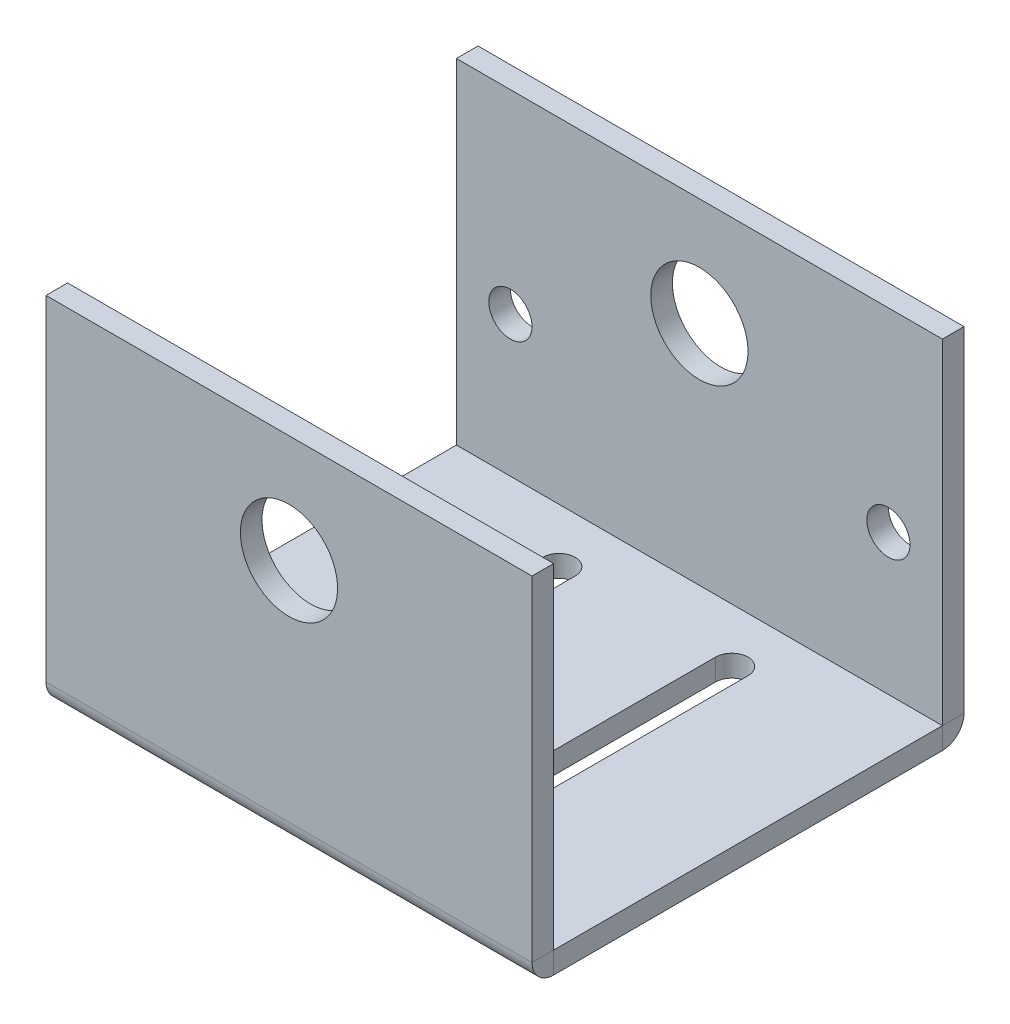
from build123d import *

# Parameters (mm, degrees)
SZKIC1_W                       = 45
SZKIC1_H                       = 40
ODGI_CIE_BAZOWE1_DEPTH         = 2
ODGI_CIE_START                 = -22.5
ODGI_CIE_KRAW_DZI1_DEPTH       = 45
ODGI_CIE_KRAW_DZI1_2_OUTLINE_W = 31
ODGI_CIE_KRAW_DZI1_2_OUTLINE_H = 2
ODGI_CIE_KRAW_DZI1_2_DEPTH     = 45
WYTNIJ_WYCI_GNI_CIE1_REACH     = 45.212
SZKIC13_R                      = 4.5
WYTNIJ_WYCI_GNI_CIE2_DEPTH     = 56.38275905
WYTNIJ_WYCI_GNI_CIE3_REACH     = 57.383
SZKIC14_R                      = 2


# Read off the part's stored shape, not the designer's step: Odgięcie krawędzi1
# Sheet-metal steps are written as plain solids
with BuildPart() as part:
    # Szkic1 → Odgięcie bazowe1 (new body)
    with BuildSketch(Plane(origin=(0, 0, 0), x_dir=(1, 0, 0), z_dir=(0, 1, 0))):
        Rectangle(SZKIC1_W, SZKIC1_H)
    extrude(amount=-ODGI_CIE_BAZOWE1_DEPTH)

    # Odgięcie krawędzi1 outline → Odgięcie krawędzi1 (cut)
    with BuildSketch(Plane.YZ.offset(ODGI_CIE_START)):
        with BuildLine():
            ThreePointArc((0, -20), (-1.414213562, -19.414213562), (-2, -18))
            Line((-2, -18), (-2, -20))
            Line((-2, -20), (0, -20))
        make_face()
        with BuildLine():
            Line((-2, 20), (-2, 18))
            ThreePointArc((-2, 18), (-1.414213562, 19.414213562), (0, 20))
            Line((0, 20), (-2, 20))
        make_face()
    extrude(amount=ODGI_CIE_KRAW_DZI1_DEPTH, mode=Mode.SUBTRACT)

    # Odgi_cie kraw_dzi1 2 outline → Odgi_cie kraw_dzi1 2 (add)
    with BuildSketch(Plane.YZ.offset(ODGI_CIE_START)):
        with Locations((15.5, -19)):
            Rectangle(ODGI_CIE_KRAW_DZI1_2_OUTLINE_W, ODGI_CIE_KRAW_DZI1_2_OUTLINE_H)
        with Locations((15.5, 19)):
            Rectangle(ODGI_CIE_KRAW_DZI1_2_OUTLINE_W, ODGI_CIE_KRAW_DZI1_2_OUTLINE_H)
    extrude(amount=ODGI_CIE_KRAW_DZI1_2_DEPTH)

    # Szkic12 → Wytnij-wyciągnięcie1 (cut, up to next)
    with BuildSketch(Plane(origin=(0, 0, 0), x_dir=(1, 0, 0), z_dir=(0, 1, 0)), mode=Mode.PRIVATE) as wytnij_wyci_gni_cie1_sk1:
        with BuildLine():
            Line((-9.5, -13), (-9.5, 13))
            ThreePointArc((-9.5, 13), (-8, 14.5), (-6.5, 13))
            Line((-6.5, 13), (-6.5, -13))
            ThreePointArc((-6.5, -13), (-8, -14.5), (-9.5, -13))
        make_face()
    wytnij_wyci_gni_cie1_tool1 = extrude(wytnij_wyci_gni_cie1_sk1.sketch, amount=-WYTNIJ_WYCI_GNI_CIE1_REACH, mode=Mode.PRIVATE) & part.part
    wytnij_wyci_gni_cie1 = wytnij_wyci_gni_cie1_tool1.solids().sort_by_distance((-8, 0, 0))[0]
    add(wytnij_wyci_gni_cie1, mode=Mode.SUBTRACT)

    # Lustro1: Wytnij-wyciągnięcie1 across plane
    add(wytnij_wyci_gni_cie1.mirror(Plane(origin=(0, 0, 0), x_dir=(0, 0, 1), z_dir=(1, 0, 0))), mode=Mode.SUBTRACT)

    # Szkic13 → Wytnij-wyciągnięcie2 (cut, through all)
    with BuildSketch(Plane(origin=(0, 0, -20), x_dir=(-1, 0, 0), z_dir=(0, 0, -1))):
        with Locations(Location((0, 21, 0), (0, 0, 90))):
            Circle(SZKIC13_R)
    extrude(amount=-WYTNIJ_WYCI_GNI_CIE2_DEPTH, mode=Mode.SUBTRACT)

    # Szkic14 → Wytnij-wyciągnięcie3 (cut, up to next)
    with BuildSketch(Plane(origin=(0, 0, -20), x_dir=(-1, 0, 0), z_dir=(0, 0, -1)), mode=Mode.PRIVATE) as wytnij_wyci_gni_cie3_sk1:
        with Locations(Location((-17.5, 13, 0), (0, 0, 90))):
            Circle(SZKIC14_R)
    wytnij_wyci_gni_cie3_tool1 = extrude(wytnij_wyci_gni_cie3_sk1.sketch, amount=-WYTNIJ_WYCI_GNI_CIE3_REACH, mode=Mode.PRIVATE) & part.part
    # Szkic14 → Wytnij-wyciągnięcie3 (cut, up to next)
    with BuildSketch(Plane(origin=(0, 0, -20), x_dir=(-1, 0, 0), z_dir=(0, 0, -1)), mode=Mode.PRIVATE) as wytnij_wyci_gni_cie3_sk2:
        with Locations(Location((17.5, 13, 0), (0, 0, 90))):
            Circle(SZKIC14_R)
    wytnij_wyci_gni_cie3_tool2 = extrude(wytnij_wyci_gni_cie3_sk2.sketch, amount=-WYTNIJ_WYCI_GNI_CIE3_REACH, mode=Mode.PRIVATE) & part.part
    add(wytnij_wyci_gni_cie3_tool1.solids().sort_by_distance((17.5, 13, -20))[0], mode=Mode.SUBTRACT)
    add(wytnij_wyci_gni_cie3_tool2.solids().sort_by_distance((-17.5, 13, -20))[0], mode=Mode.SUBTRACT)


solid = part.part
